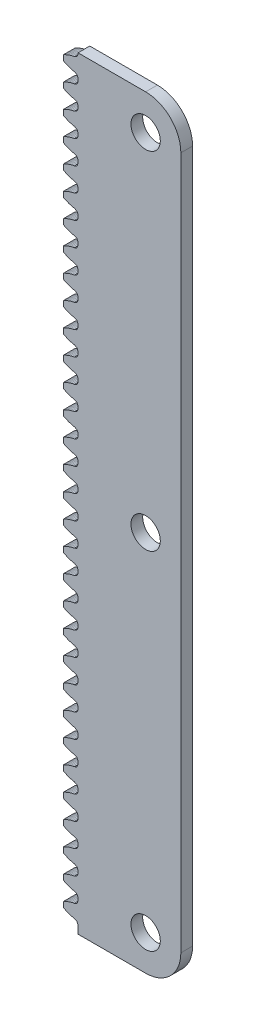
from build123d import *

# Parameters (mm, degrees)
SKETCH_1_W             = 20
SKETCH_1_H             = 130
SM_BASE_FLANGE_1_DEPTH = 2
FILLET_1_R             = 6
SKETCH_4_R             = 2.5
CUT_EXTRUDE_1_DEPTH    = 10
CUT_EXTRUDE_2_DEPTH    = 10


# Sheet-metal steps are written as plain solids
with BuildPart() as part:
    # Sketch 1 → Базовая кромка1 (new body)
    with BuildSketch(Plane.XY):
        with Locations((-7.578745157, -15.108264947)):
            Rectangle(SKETCH_1_W, SKETCH_1_H)
    extrude(amount=-SM_BASE_FLANGE_1_DEPTH)

    # Скругление1
    fillet_1_edges = [part.edges().sort_by_distance(p)[0] for p in [
        (2.421254843, 49.891735053, -1),
        (2.421254843, -80.108264947, -1),
    ]]
    fillet(fillet_1_edges, radius=FILLET_1_R)

    # Эскиз4 → Вырез-Вытянуть1 (cut)
    with BuildSketch(Plane.XY):
        with Locations((-3.578745157, -15.108264947)):
            Circle(SKETCH_4_R)
        with Locations((-3.578745157, 43.891735053)):
            Circle(SKETCH_4_R)
        with Locations((-3.578745157, -74.108264947)):
            Circle(SKETCH_4_R)
    extrude(amount=-CUT_EXTRUDE_1_DEPTH, mode=Mode.SUBTRACT)

    # Эскиз5 → Вырез-Вытянуть2 (cut)
    with BuildSketch(Plane(origin=(0, 0, -2), x_dir=(-1, 0, 0), z_dir=(0, 0, -1))):
        Polygon((15.137914712, 49.536376423), (15.275734734, 49.234957699), (15.70764754, 49.026878367), (16.018738854, 48.968032256), (16.330930494, 48.885096777), (16.643600008, 48.781405699), (16.956236055, 48.658838618), (17.26837661, 48.518617683), (17.579585944, 48.361606423), (17.579585944, 47.461938769), (17.26837661, 47.30492751), (16.956236055, 47.164706574), (16.643600008, 47.042139494), (16.330930494, 46.938448415), (16.018738854, 46.855512936), (15.70764754, 46.796666825), (15.275734734, 46.588587493), (15.137914712, 46.287168769), (15.088676086, 45.897404906), (15.137914712, 45.507641044), (15.275734734, 45.206222319), (15.70764754, 44.998142987), (16.018738854, 44.939296876), (16.330930494, 44.856361397), (16.643600008, 44.752670319), (16.956236055, 44.630103239), (17.26837661, 44.489882303), (17.579585944, 44.332871044), (17.579585944, 43.43320339), (17.26837661, 43.27619213), (16.956236055, 43.135971195), (16.643600008, 43.013404114), (16.330930494, 42.909713036), (16.018738854, 42.826777557), (15.70764754, 42.767931446), (15.275734734, 42.559852114), (15.137914712, 42.25843339), (15.088676086, 41.868669527), (15.137914712, 41.478905664), (15.275734734, 41.17748694), (15.70764754, 40.969407608), (16.018738854, 40.910561497), (16.330930494, 40.827626018), (16.643600008, 40.723934939), (16.956236055, 40.601367859), (17.26837661, 40.461146923), (17.579585944, 40.304135664), (17.579585944, 39.40446801), (17.26837661, 39.247456751), (16.956236055, 39.107235815), (16.643600008, 38.984668735), (16.330930494, 38.880977656), (16.018738854, 38.798042177), (15.70764754, 38.739196066), (15.275734734, 38.531116734), (15.137914712, 38.22969801), (15.088676086, 37.839934147), (15.137914712, 37.450170284), (15.275734734, 37.14875156), (15.70764754, 36.940672228), (16.018738854, 36.881826117), (16.330930494, 36.798890638), (16.643600008, 36.69519956), (16.956236055, 36.572632479), (17.26837661, 36.432411544), (17.579585944, 36.275400284), (17.579585944, 35.37573263), (17.26837661, 35.218721371), (16.956236055, 35.078500435), (16.643600008, 34.955933355), (16.330930494, 34.852242277), (16.018738854, 34.769306797), (15.70764754, 34.710460686), (15.275734734, 34.502381354), (15.137914712, 34.20096263), (15.088676086, 33.811198767), (15.137914712, 33.421434905), (15.275734734, 33.12001618), (15.70764754, 32.911936848), (16.018738854, 32.853090738), (16.330930494, 32.770155258), (16.643600008, 32.66646418), (16.956236055, 32.5438971), (17.26837661, 32.403676164), (17.579585944, 32.246664905), (17.579585944, 31.346997251), (17.26837661, 31.189985991), (16.956236055, 31.049765056), (16.643600008, 30.927197975), (16.330930494, 30.823506897), (16.018738854, 30.740571418), (15.70764754, 30.681725307), (15.275734734, 30.473645975), (15.137914712, 30.172227251), (15.088676086, 29.782463388), (15.137914712, 29.392699525), (15.275734734, 29.091280801), (15.70764754, 28.883201469), (16.018738854, 28.824355358), (16.330930494, 28.741419879), (16.643600008, 28.6377288), (16.956236055, 28.51516172), (17.26837661, 28.374940784), (17.579585944, 28.217929525), (17.579585944, 27.318261871), (17.26837661, 27.161250612), (16.956236055, 27.021029676), (16.643600008, 26.898462596), (16.330930494, 26.794771517), (16.018738854, 26.711836038), (15.70764754, 26.652989927), (15.275734734, 26.444910595), (15.137914712, 26.143491871), (15.088676086, 25.753728008), (15.137914712, 25.363964145), (15.275734734, 25.062545421), (15.70764754, 24.854466089), (16.018738854, 24.795619978), (16.330930494, 24.712684499), (16.643600008, 24.608993421), (16.956236055, 24.48642634), (17.26837661, 24.346205405), (17.579585944, 24.189194145), (17.579585944, 23.289526491), (17.26837661, 23.132515232), (16.956236055, 22.992294296), (16.643600008, 22.869727216), (16.330930494, 22.766036138), (16.018738854, 22.683100658), (15.70764754, 22.624254548), (15.275734734, 22.416175215), (15.137914712, 22.114756491), (15.088676086, 21.724992629), (15.137914712, 21.335228766), (15.275734734, 21.033810042), (15.70764754, 20.825730709), (16.018738854, 20.766884599), (16.330930494, 20.683949119), (16.643600008, 20.580258041), (16.956236055, 20.457690961), (17.26837661, 20.317470025), (17.579585944, 20.160458766), (17.579585944, 19.260791112), (17.26837661, 19.103779852), (16.956236055, 18.963558917), (16.643600008, 18.840991836), (16.330930494, 18.737300758), (16.018738854, 18.654365279), (15.70764754, 18.595519168), (15.275734734, 18.387439836), (15.137914712, 18.086021112), (15.088676086, 17.696257249), (15.137914712, 17.306493386), (15.275734734, 17.005074662), (15.70764754, 16.79699533), (16.018738854, 16.738149219), (16.330930494, 16.65521374), (16.643600008, 16.551522661), (16.956236055, 16.428955581), (17.26837661, 16.288734645), (17.579585944, 16.131723386), (17.579585944, 15.232055732), (17.26837661, 15.075044473), (16.956236055, 14.934823537), (16.643600008, 14.812256457), (16.330930494, 14.708565378), (16.018738854, 14.625629899), (15.70764754, 14.566783788), (15.275734734, 14.358704456), (15.137914712, 14.057285732), (15.088676086, 13.667521869), (15.137914712, 13.277758006), (15.275734734, 12.976339282), (15.70764754, 12.76825995), (16.018738854, 12.709413839), (16.330930494, 12.62647836), (16.643600008, 12.522787282), (16.956236055, 12.400220201), (17.26837661, 12.259999266), (17.579585944, 12.102988006), (17.579585944, 11.203320352), (17.26837661, 11.046309093), (16.956236055, 10.906088157), (16.643600008, 10.783521077), (16.330930494, 10.679829999), (16.018738854, 10.59689452), (15.70764754, 10.538048409), (15.275734734, 10.329969077), (15.137914712, 10.028550352), (15.088676086, 9.63878649), (15.137914712, 9.249022627), (15.275734734, 8.947603903), (15.70764754, 8.739524571), (16.018738854, 8.68067846), (16.330930494, 8.59774298), (16.643600008, 8.494051902), (16.956236055, 8.371484822), (17.26837661, 8.231263886), (17.579585944, 8.074252627), (17.579585944, 7.174584973), (17.26837661, 7.017573713), (16.956236055, 6.877352778), (16.643600008, 6.754785697), (16.330930494, 6.651094619), (16.018738854, 6.56815914), (15.70764754, 6.509313029), (15.275734734, 6.301233697), (15.137914712, 5.999814973), (15.088676086, 5.61005111), (15.137914712, 5.220287247), (15.275734734, 4.918868523), (15.70764754, 4.710789191), (16.018738854, 4.65194308), (16.330930494, 4.569007601), (16.643600008, 4.465316522), (16.956236055, 4.342749442), (17.26837661, 4.202528506), (17.579585944, 4.045517247), (17.579585944, 3.145849593), (17.26837661, 2.988838334), (16.956236055, 2.848617398), (16.643600008, 2.726050318), (16.330930494, 2.622359239), (16.018738854, 2.53942376), (15.70764754, 2.480577649), (15.275734734, 2.272498317), (15.137914712, 1.971079593), (15.088676086, 1.58131573), (15.137914712, 1.191551867), (15.275734734, 0.890133143), (15.70764754, 0.682053811), (16.018738854, 0.6232077), (16.330930494, 0.540272221), (16.643600008, 0.436581143), (16.956236055, 0.314014062), (17.26837661, 0.173793127), (17.579585944, 0.016781867), (17.579585944, -0.882885787), (17.26837661, -1.039897046), (16.956236055, -1.180117982), (16.643600008, -1.302685062), (16.330930494, -1.40637614), (16.018738854, -1.489311619), (15.70764754, -1.54815773), (15.275734734, -1.756237062), (15.137914712, -2.057655787), (15.088676086, -2.447419649), (15.137914712, -2.837183512), (15.275734734, -3.138602236), (15.70764754, -3.346681568), (16.018738854, -3.405527679), (16.330930494, -3.488463158), (16.643600008, -3.592154237), (16.956236055, -3.714721317), (17.26837661, -3.854942253), (17.579585944, -4.011953512), (17.579585944, -4.911621166), (17.26837661, -5.068632426), (16.956236055, -5.208853361), (16.643600008, -5.331420442), (16.330930494, -5.43511152), (16.018738854, -5.518046999), (15.70764754, -5.57689311), (15.275734734, -5.784972442), (15.137914712, -6.086391166), (15.088676086, -6.476155029), (15.137914712, -6.865918892), (15.275734734, -7.167337616), (15.70764754, -7.375416948), (16.018738854, -7.434263059), (16.330930494, -7.517198538), (16.643600008, -7.620889617), (16.956236055, -7.743456697), (17.26837661, -7.883677633), (17.579585944, -8.040688892), (17.579585944, -8.940356546), (17.26837661, -9.097367805), (16.956236055, -9.237588741), (16.643600008, -9.360155821), (16.330930494, -9.4638469), (16.018738854, -9.546782379), (15.70764754, -9.60562849), (15.275734734, -9.813707822), (15.137914712, -10.115126546), (15.088676086, -10.504890409), (15.137914712, -10.894654272), (15.275734734, -11.196072996), (15.70764754, -11.404152328), (16.018738854, -11.462998439), (16.330930494, -11.545933918), (16.643600008, -11.649624996), (16.956236055, -11.772192077), (17.26837661, -11.912413012), (17.579585944, -12.069424272), (17.579585944, -12.969091926), (17.26837661, -13.126103185), (16.956236055, -13.266324121), (16.643600008, -13.388891201), (16.330930494, -13.492582279), (16.018738854, -13.575517758), (15.70764754, -13.634363869), (15.275734734, -13.842443201), (15.137914712, -14.143861926), (15.088676086, -14.533625788), (15.137914712, -14.923389651), (15.275734734, -15.224808375), (15.70764754, -15.432887707), (16.018738854, -15.491733818), (16.330930494, -15.574669297), (16.643600008, -15.678360376), (16.956236055, -15.800927456), (17.26837661, -15.941148392), (17.579585944, -16.098159651), (17.579585944, -16.997827305), (17.26837661, -17.154838565), (16.956236055, -17.2950595), (16.643600008, -17.41762658), (16.330930494, -17.521317659), (16.018738854, -17.604253138), (15.70764754, -17.663099249), (15.275734734, -17.871178581), (15.137914712, -18.172597305), (15.088676086, -18.562361168), (15.137914712, -18.952125031), (15.275734734, -19.253543755), (15.70764754, -19.461623087), (16.018738854, -19.520469198), (16.330930494, -19.603404677), (16.643600008, -19.707095756), (16.956236055, -19.829662836), (17.26837661, -19.969883772), (17.579585944, -20.126895031), (17.579585944, -21.026562685), (17.26837661, -21.183573944), (16.956236055, -21.32379488), (16.643600008, -21.44636196), (16.330930494, -21.550053039), (16.018738854, -21.632988518), (15.70764754, -21.691834629), (15.275734734, -21.899913961), (15.137914712, -22.201332685), (15.088676086, -22.591096548), (15.137914712, -22.980860411), (15.275734734, -23.282279135), (15.70764754, -23.490358467), (16.018738854, -23.549204578), (16.330930494, -23.632140057), (16.643600008, -23.735831135), (16.956236055, -23.858398215), (17.26837661, -23.998619151), (17.579585944, -24.155630411), (17.579585944, -25.055298065), (17.26837661, -25.212309324), (16.956236055, -25.35253026), (16.643600008, -25.47509734), (16.330930494, -25.578788418), (16.018738854, -25.661723897), (15.70764754, -25.720570008), (15.275734734, -25.92864934), (15.137914712, -26.230068065), (15.088676086, -26.619831927), (15.137914712, -27.00959579), (15.275734734, -27.311014514), (15.70764754, -27.519093846), (16.018738854, -27.577939957), (16.330930494, -27.660875436), (16.643600008, -27.764566515), (16.956236055, -27.887133595), (17.26837661, -28.027354531), (17.579585944, -28.18436579), (17.579585944, -29.084033444), (17.26837661, -29.241044704), (16.956236055, -29.381265639), (16.643600008, -29.503832719), (16.330930494, -29.607523798), (16.018738854, -29.690459277), (15.70764754, -29.749305388), (15.275734734, -29.95738472), (15.137914712, -30.258803444), (15.088676086, -30.648567307), (15.137914712, -31.03833117), (15.275734734, -31.339749894), (15.70764754, -31.547829226), (16.018738854, -31.606675337), (16.330930494, -31.689610816), (16.643600008, -31.793301895), (16.956236055, -31.915868975), (17.26837661, -32.05608991), (17.579585944, -32.21310117), (17.579585944, -33.112768824), (17.26837661, -33.269780083), (16.956236055, -33.410001019), (16.643600008, -33.532568099), (16.330930494, -33.636259178), (16.018738854, -33.719194657), (15.70764754, -33.778040768), (15.275734734, -33.9861201), (15.137914712, -34.287538824), (15.088676086, -34.677302687), (15.137914712, -35.067066549), (15.275734734, -35.368485274), (15.70764754, -35.576564606), (16.018738854, -35.635410717), (16.330930494, -35.718346196), (16.643600008, -35.822037274), (16.956236055, -35.944604354), (17.26837661, -36.08482529), (17.579585944, -36.24183655), (17.579585944, -37.141504204), (17.26837661, -37.298515463), (16.956236055, -37.438736399), (16.643600008, -37.561303479), (16.330930494, -37.664994557), (16.018738854, -37.747930036), (15.70764754, -37.806776147), (15.275734734, -38.014855479), (15.137914712, -38.316274204), (15.088676086, -38.706038066), (15.137914712, -39.095801929), (15.275734734, -39.397220653), (15.70764754, -39.605299985), (16.018738854, -39.664146096), (16.330930494, -39.747081575), (16.643600008, -39.850772654), (16.956236055, -39.973339734), (17.26837661, -40.11356067), (17.579585944, -40.270571929), (17.579585944, -41.170239583), (17.26837661, -41.327250843), (16.956236055, -41.467471778), (16.643600008, -41.590038858), (16.330930494, -41.693729937), (16.018738854, -41.776665416), (15.70764754, -41.835511527), (15.275734734, -42.043590859), (15.137914712, -42.345009583), (15.088676086, -42.734773446), (15.137914712, -43.124537309), (15.275734734, -43.425956033), (15.70764754, -43.634035365), (16.018738854, -43.692881476), (16.330930494, -43.775816955), (16.643600008, -43.879508034), (16.956236055, -44.002075114), (17.26837661, -44.142296049), (17.579585944, -44.299307309), (17.579585944, -45.198974963), (17.26837661, -45.355986222), (16.956236055, -45.496207158), (16.643600008, -45.618774238), (16.330930494, -45.722465317), (16.018738854, -45.805400796), (15.70764754, -45.864246907), (15.275734734, -46.072326239), (15.137914712, -46.373744963), (15.088676086, -46.763508826), (15.137914712, -47.153272688), (15.275734734, -47.454691413), (15.70764754, -47.662770745), (16.018738854, -47.721616856), (16.330930494, -47.804552335), (16.643600008, -47.908243413), (16.956236055, -48.030810493), (17.26837661, -48.171031429), (17.579585944, -48.328042688), (17.579585944, -49.227710342), (17.26837661, -49.384721602), (16.956236055, -49.524942538), (16.643600008, -49.647509618), (16.330930494, -49.751200696), (16.018738854, -49.834136175), (15.70764754, -49.892982286), (15.275734734, -50.101061618), (15.137914712, -50.402480343), (15.088676086, -50.792244205), (15.137914712, -51.182008068), (15.275734734, -51.483426792), (15.70764754, -51.691506124), (16.018738854, -51.750352235), (16.330930494, -51.833287714), (16.643600008, -51.936978793), (16.956236055, -52.059545873), (17.26837661, -52.199766809), (17.579585944, -52.356778068), (17.579585944, -53.256445722), (17.26837661, -53.413456982), (16.956236055, -53.553677917), (16.643600008, -53.676244997), (16.330930494, -53.779936076), (16.018738854, -53.862871555), (15.70764754, -53.921717666), (15.275734734, -54.129796998), (15.137914712, -54.431215722), (15.088676086, -54.820979585), (15.137914712, -55.210743448), (15.275734734, -55.512162172), (15.70764754, -55.720241504), (16.018738854, -55.779087615), (16.330930494, -55.862023094), (16.643600008, -55.965714173), (16.956236055, -56.088281253), (17.26837661, -56.228502188), (17.579585944, -56.385513448), (17.579585944, -57.285181102), (17.26837661, -57.442192361), (16.956236055, -57.582413297), (16.643600008, -57.704980377), (16.330930494, -57.808671456), (16.018738854, -57.891606935), (15.70764754, -57.950453046), (15.275734734, -58.158532378), (15.137914712, -58.459951102), (15.088676086, -58.849714965), (15.137914712, -59.239478827), (15.275734734, -59.540897552), (15.70764754, -59.748976884), (16.018738854, -59.807822995), (16.330930494, -59.890758474), (16.643600008, -59.994449552), (16.956236055, -60.117016632), (17.26837661, -60.257237568), (17.579585944, -60.414248827), (17.579585944, -61.313916481), (17.26837661, -61.470927741), (16.956236055, -61.611148677), (16.643600008, -61.733715757), (16.330930494, -61.837406835), (16.018738854, -61.920342314), (15.70764754, -61.979188425), (15.275734734, -62.187267757), (15.137914712, -62.488686481), (15.088676086, -62.878450344), (15.137914712, -63.268214207), (15.275734734, -63.569632931), (15.70764754, -63.777712263), (16.018738854, -63.836558374), (16.330930494, -63.919493853), (16.643600008, -64.023184932), (16.956236055, -64.145752012), (17.26837661, -64.285972948), (17.579585944, -64.442984207), (17.579585944, -65.342651861), (17.26837661, -65.49966312), (16.956236055, -65.639884056), (16.643600008, -65.762451136), (16.330930494, -65.866142215), (16.018738854, -65.949077694), (15.70764754, -66.007923805), (15.275734734, -66.216003137), (15.137914712, -66.517421861), (15.088676086, -66.907185724), (15.137914712, -67.296949587), (15.275734734, -67.598368311), (15.70764754, -67.806447643), (16.018738854, -67.865293754), (16.330930494, -67.948229233), (16.643600008, -68.051920312), (16.956236055, -68.174487392), (17.26837661, -68.314708327), (17.579585944, -68.471719587), (17.579585944, -69.371387241), (17.26837661, -69.5283985), (16.956236055, -69.668619436), (16.643600008, -69.791186516), (16.330930494, -69.894877595), (16.018738854, -69.977813074), (15.70764754, -70.036659185), (15.275734734, -70.244738517), (15.137914712, -70.546157241), (15.088676086, -70.935921104), (15.137914712, -71.325684966), (15.275734734, -71.627103691), (15.70764754, -71.835183023), (16.018738854, -71.894029134), (16.330930494, -71.976964613), (16.643600008, -72.080655691), (16.956236055, -72.203222771), (17.26837661, -72.343443707), (17.579585944, -72.500454966), (17.579585944, -73.40012262), (17.26837661, -73.55713388), (16.956236055, -73.697354815), (16.643600008, -73.819921896), (16.330930494, -73.923612974), (16.018738854, -74.006548453), (15.70764754, -74.065394564), (15.275734734, -74.273473896), (15.137914712, -74.57489262), (15.088676086, -74.964656483), (15.137914712, -75.354420346), (15.275734734, -75.65583907), (15.70764754, -75.863918402), (16.018738854, -75.922764513), (16.330930494, -76.005699992), (16.643600008, -76.109391071), (16.956236055, -76.231958151), (17.26837661, -76.372179087), (17.579585944, -76.529190346), (17.579585944, -77.428858), (17.26837661, -77.585869259), (16.956236055, -77.726090195), (16.643600008, -77.848657275), (16.330930494, -77.952348354), (16.018738854, -78.035283833), (15.70764754, -78.094129944), (15.275734734, -78.302209276), (15.137914712, -78.603628), (15.088676086, -78.993391863), (15.088676086, -80.232082604), (18.85287408, -80.232082604), (18.85287408, 51.236207677), (15.088676086, 51.236207677), (15.088676086, 49.926140286), align=None)
    extrude(amount=-CUT_EXTRUDE_2_DEPTH, mode=Mode.SUBTRACT)


solid = part.part
